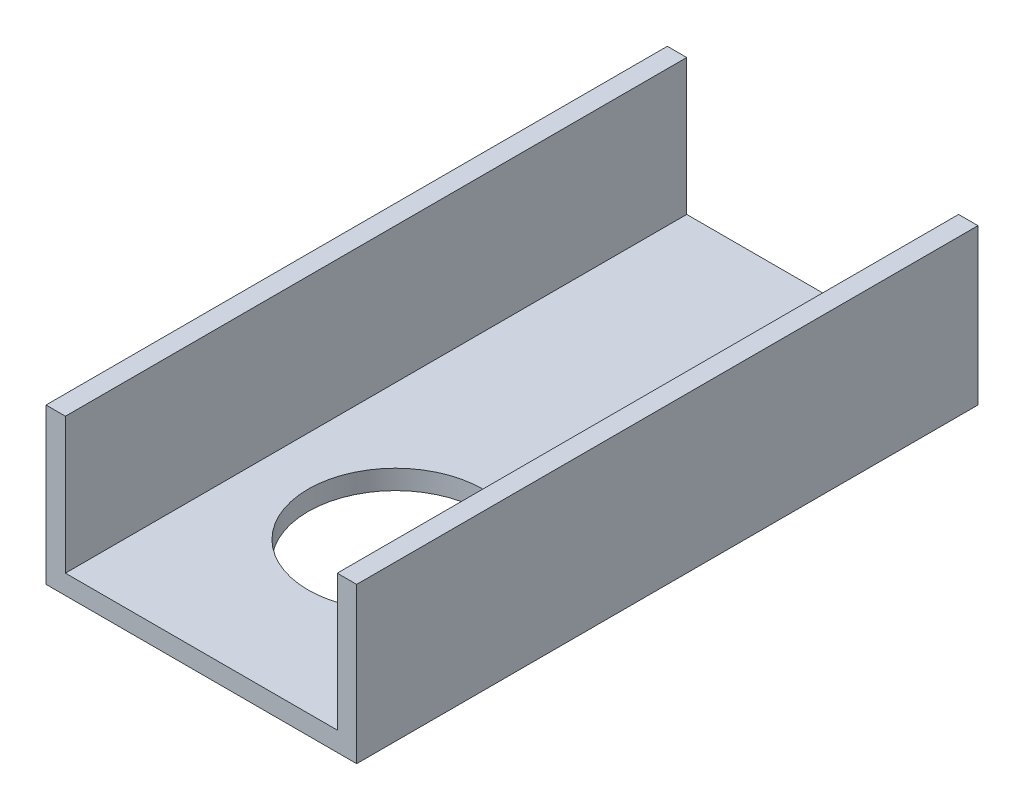
from build123d import *

# Parameters (mm, degrees)
BOSS_EXTRUDE1_DEPTH = 101.6
CUT_EXTRUDE1_REACH  = 118.397
SKETCH2_R           = 14.2875
CUT_EXTRUDE2_REACH  = 117.746
SKETCH3_W           = 3.175
SKETCH3_H           = 22.225


with BuildPart() as part:
    # Sketch1 → Boss-Extrude1 (new body)
    with BuildSketch(Plane.XY):
        Polygon((47.625, 3.175), (47.625, 25.4), (50.8, 25.4), (50.8, 0), (0, 0), (0, 25.4), (3.175, 25.4), (3.175, 3.175), align=None)
    extrude(amount=BOSS_EXTRUDE1_DEPTH)

    # Sketch2 → Cut-Extrude1 (cut, up to next)
    with BuildSketch(Plane.XZ, mode=Mode.PRIVATE) as cut_extrude1_sk1:
        with Locations((25.4, 69.85)):
            Circle(SKETCH2_R)
    cut_extrude1_tool1 = extrude(cut_extrude1_sk1.sketch, amount=-CUT_EXTRUDE1_REACH, mode=Mode.PRIVATE) & part.part
    add(cut_extrude1_tool1.solids().sort_by_distance((25.4, 0, 69.85))[0], mode=Mode.SUBTRACT)

    # Sketch3 → Cut-Extrude2 (cut, up to next)
    with BuildSketch(Plane(origin=(0, 3.175, 0), x_dir=(1, 0, 0), z_dir=(0, 1, 0)), mode=Mode.PRIVATE) as cut_extrude2_sk1:
        with Locations((46.0375, -11.1125)):
            Rectangle(SKETCH3_W, SKETCH3_H)
    cut_extrude2_tool1 = extrude(cut_extrude2_sk1.sketch, amount=-CUT_EXTRUDE2_REACH, mode=Mode.PRIVATE) & part.part
    add(cut_extrude2_tool1.solids().sort_by_distance((46.0375, 3.175, 11.1125))[0], mode=Mode.SUBTRACT)


solid = part.part
